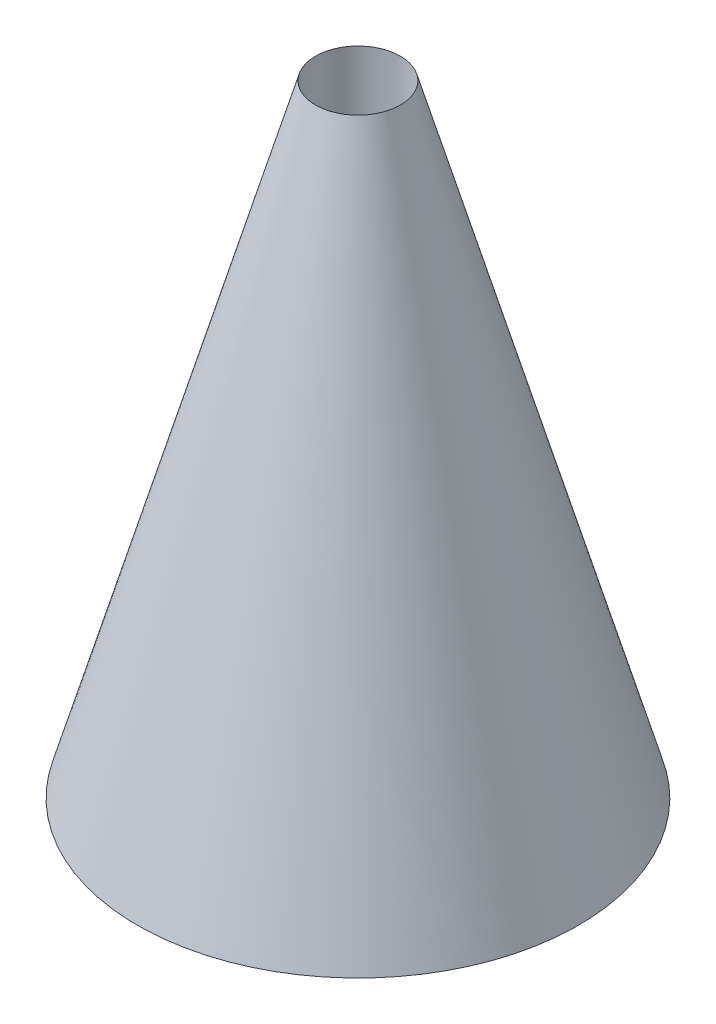
from build123d import *

# Parameters (mm, degrees)
SKETCH2_R          = 2.5
CUT_EXTRUDE1_DEPTH = 49.929390314


with BuildPart() as part:
    # Sketch1 → Revolve1 (revolve)
    with BuildSketch(Plane.XY):
        Polygon((0, 325.102863253), (0, 279.758787162), (13, 279.758787162), align=None)
    revolve(axis=Axis((0, 0, 0), (0, 1, 0)))

    # Sketch2 → Cut-Extrude1 (cut, through all)
    with BuildSketch(Plane.XZ.offset(-279.758787162)):
        Circle(SKETCH2_R)
    extrude(amount=-CUT_EXTRUDE1_DEPTH, mode=Mode.SUBTRACT)


solid = part.part
